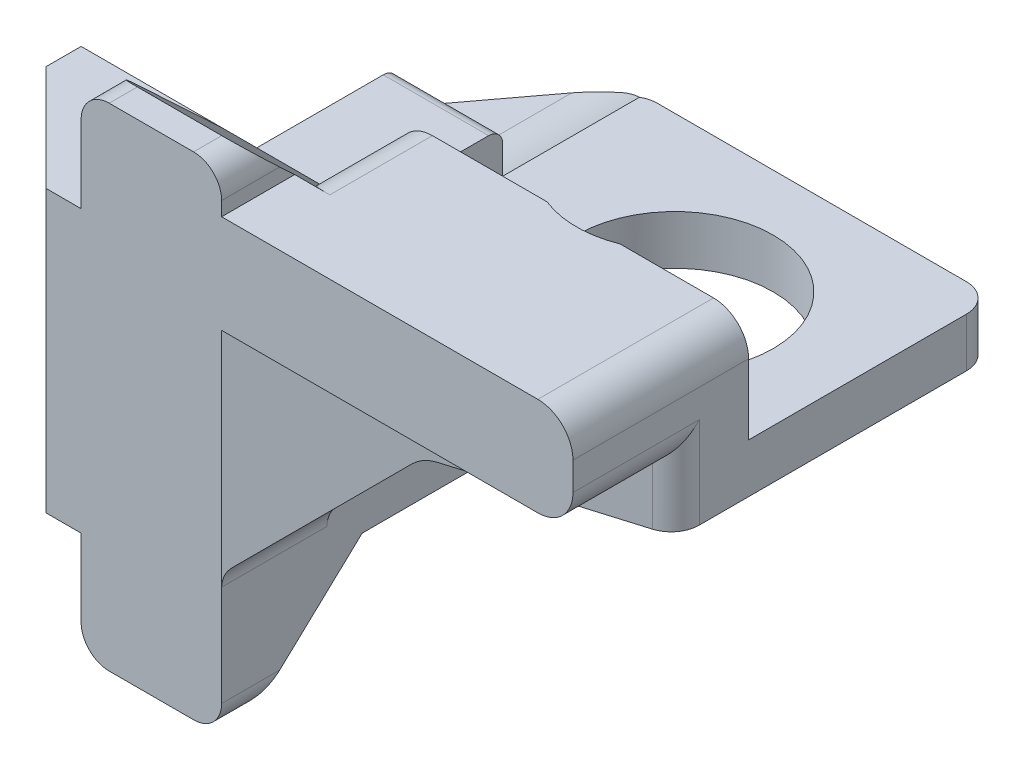
from build123d import *

# Parameters (mm, degrees)
SKETCH1_W                = 40
SKETCH1_H                = 40
BOSS_EXTRUDE1_DEPTH      = 40
SKETCH2_W                = 25
SKETCH2_H                = 20
CUT_EXTRUDE1_DEPTH       = 40
CHAMFER1_SIZE            = 15
CUT_EXTRUDE2_DEPTH       = 15
CHAMFER2_SIZE            = 4
SKETCH4_R                = 2.6
CUT_EXTRUDE3_DEPTH       = 17
BOSS_EXTRUDE3_DEPTH      = 20
FILLET3_R                = 4
BOSS_EXTRUDE2_DEPTH      = 20
BOSS_EXTRUDE2_DEPTH_BACK = 25
SKETCH5_W                = 50
SKETCH5_H                = 8
SKETCH10_R               = 14
CUT_EXTRUDE4_DEPTH       = 10
CHAMFER3_SIZE            = 15
CHAMFER3_SIZE_2          = 20
CHAMFER4_SIZE2           = 50
CHAMFER4_SIZE            = 15
FILLET5_START            = 26
FILLET5_DEPTH            = 10
FILLET6_R                = 2
CHAMFER5_SIZE            = 22
SKETCH11_W               = 27.237482008
SKETCH11_H               = 25
CUT_EXTRUDE5_DEPTH       = 25
FILLET7_R                = 4
SKETCH16_W               = 14
SKETCH16_H               = 14
CUT_EXTRUDE6_DEPTH       = 43
CHAMFER6_SIZE            = 10
CHAMFER6_SIZE2           = 2
FILLET9_R                = 2
SKETCH18_W               = 50
SKETCH18_H               = 14
BOSS_EXTRUDE4_DEPTH      = 25
SKETCH19_R               = 2.25
CUT_EXTRUDE7_DEPTH       = 15
FILLET10_R               = 5
SKETCH20_W               = 50
SKETCH20_H               = 1
CUT_EXTRUDE8_DEPTH       = 69
FILLET11_R               = 10
SKETCH21_R               = 14
CUT_EXTRUDE9_DEPTH       = 69


with BuildPart() as part:
    # Sketch1 → Boss-Extrude1 (new body)
    with BuildSketch(Plane(origin=(0, 0, 0), x_dir=(1, 0, 0), z_dir=(0, 1, 0))):
        with Locations((20, 20)):
            Rectangle(SKETCH1_W, SKETCH1_H)
    extrude(amount=BOSS_EXTRUDE1_DEPTH)

    # Sketch2 → Cut-Extrude1 (cut)
    with BuildSketch(Plane(origin=(0, 40, 0), x_dir=(1, 0, 0), z_dir=(0, 1, 0))):
        with Locations((12.5, 30)):
            Rectangle(SKETCH2_W, SKETCH2_H)
    extrude(amount=-CUT_EXTRUDE1_DEPTH, mode=Mode.SUBTRACT)

    # Chamfer1
    chamfer1_edges = [part.edges().sort_by_distance(p)[0] for p in [
        (0, 20, 0),
    ]]
    chamfer(chamfer1_edges, length=CHAMFER1_SIZE)

    # Sketch3 → Cut-Extrude2 (cut)
    with BuildSketch(Plane.XY):
        Polygon((0, 10), (0, 15), (15, 15), (15, 5), (0, 5), align=None)
        Polygon((0, 30), (0, 25), (15, 25), (15, 35), (0, 35), align=None)
    extrude(amount=-CUT_EXTRUDE2_DEPTH, mode=Mode.SUBTRACT)

    # Chamfer2
    chamfer2_edges = [part.edges().sort_by_distance(p)[0] for p in [
        (15, 35, -7.5),
        (15, 25, -7.5),
        (15, 15, -7.5),
        (15, 5, -7.5),
    ]]
    chamfer(chamfer2_edges, length=CHAMFER2_SIZE)

    # Sketch4 → Cut-Extrude3 (cut)
    with BuildSketch(Plane.XY.offset(-15)):
        with Locations((8, 30)):
            Circle(SKETCH4_R)
        with Locations((8, 10)):
            Circle(SKETCH4_R)
    extrude(amount=-CUT_EXTRUDE3_DEPTH, mode=Mode.SUBTRACT)

    # Sketch9 → Boss-Extrude3 (add)
    with BuildSketch(Plane(origin=(40, 0, 0), x_dir=(0, 0, -1), z_dir=(1, 0, 0))):
        Polygon((0, 40), (0, 55), (4, 55), (20, 40), align=None)
        Polygon((0, 0), (0, -15), (4, -15), (20, 0), align=None)
    extrude(amount=-BOSS_EXTRUDE3_DEPTH)

    # Fillet3
    fillet3_edges = [part.edges().sort_by_distance(p)[0] for p in [
        (20, 55, -2),
        (40, 55, -2),
        (20, -15, -2),
        (40, -15, -2),
    ]]
    fillet(fillet3_edges, radius=FILLET3_R)

    # Sketch5 → Boss-Extrude2 (add, two sides: drawn at the far end of the back side and taken through both)
    with BuildSketch(Plane(origin=(0, 0, -40), x_dir=(-1, 0, 0), z_dir=(0, 0, -1)).offset(-BOSS_EXTRUDE2_DEPTH_BACK)):
        with Locations((-65, 31)):
            Rectangle(SKETCH5_W, SKETCH5_H)
    extrude(amount=BOSS_EXTRUDE2_DEPTH + BOSS_EXTRUDE2_DEPTH_BACK)

    # Sketch10 → Cut-Extrude4 (cut)
    with BuildSketch(Plane(origin=(0, 27, 0), x_dir=(-1, 0, 0), z_dir=(0, -1, 0))):
        with Locations(Location((-66.5, 38, 0), (0, 0, 90))):
            Circle(SKETCH10_R)
    extrude(amount=-CUT_EXTRUDE4_DEPTH, mode=Mode.SUBTRACT)

    # Chamfer3
    # the kernel refuses this chamfer: 20, 15 mm, written as the material it adds along each edge
    with BuildSketch(Plane(origin=(40, 27, -40), x_dir=(-1, 0, 0), z_dir=(0, 1, 0))) as chamfer3_piece_1:
        Polygon((CHAMFER3_SIZE, 0), (0, -CHAMFER3_SIZE_2), (0, 0), align=None)
    extrude(amount=8)

    # Chamfer4
    chamfer4_edges = [part.edges().sort_by_distance(p)[0] for p in [
        (40, 31, -15),
    ]]
    chamfer4_side = [part.faces().sort_by_distance(p)[0] for p in [
        (40, 31, -14.7),
    ]]
    chamfer(chamfer4_edges, length=CHAMFER4_SIZE - 0.0001, length2=CHAMFER4_SIZE2 - 0.0001, reference=chamfer4_side[0])  # a hair under: the kernel refuses the full size

    # Fillet5: read off the stored shape, not the designer's step
    # Fillet5 outline → Fillet5 (cut)
    with BuildSketch(Plane(origin=(0, 0, 0), x_dir=(1, 0, 0), z_dir=(0, 1, 0)).offset(FILLET5_START)):
        with BuildLine():
            Line((90, 15), (90, 17.976122604))
            ThreePointArc((90, 17.976122604), (89.209171713, 15.588400485), (87.149391542, 14.144817463))
            Line((87.149391542, 14.144817463), (90, 15))
        make_face()
        with BuildLine():
            ThreePointArc((38.8, 58.4), (40.211145618, 59.577708764), (42, 60))
            Line((42, 60), (40, 60))
            Line((40, 60), (38.8, 58.4))
        make_face()
        with BuildLine():
            ThreePointArc((86, 60), (88.828427125, 58.828427125), (90, 56))
            Line((90, 56), (90, 60))
            Line((90, 60), (86, 60))
        make_face()
    extrude(amount=FILLET5_DEPTH, mode=Mode.SUBTRACT)

    # Fillet6
    fillet6_edges = [part.edges().sort_by_distance(p)[0] for p in [
        (32.5, 40, -40),
        (32.5, 0, -40),
    ]]
    fillet(fillet6_edges, radius=FILLET6_R)

    # Chamfer5
    # the kernel refuses this chamfer: 22 mm, written as the material it adds along each edge
    with BuildSketch(Plane(origin=(40, 27, 56.576925735), x_dir=(1, 0, 0), z_dir=(0, 0, -1))) as chamfer5_piece_1_section:
        Polygon((CHAMFER5_SIZE, 0), (0, CHAMFER5_SIZE), (0, 0), align=None)
    chamfer5_piece_1 = extrude(amount=96.576925735, mode=Mode.PRIVATE)
    chamfer5_piece_1 = split(chamfer5_piece_1, bisect_by=Plane(origin=(24.428402209, 27, 4.671357537), z_dir=(-0.2873466553275782, 0, -0.9578266542919204)), keep=Keep.TOP, mode=Mode.PRIVATE)
    chamfer5_piece_1 = chamfer5_piece_1 - Plane(origin=(66.5, 27, -38), x_dir=(0, 0, -1), z_dir=(0, -1, 0)) * Cylinder(14, 282, mode=Mode.PRIVATE)
    chamfer5_piece_1 = split(chamfer5_piece_1, bisect_by=Plane(origin=(40, 27, 0), z_dir=(0, 0, -1)), keep=Keep.TOP, mode=Mode.PRIVATE)
    add(chamfer5_piece_1)

    # Sketch11 → Cut-Extrude5 (cut)
    with BuildSketch(Plane(origin=(0, 0, -40), x_dir=(-1, 0, 0), z_dir=(0, 0, -1))):
        with Locations((-53.618741004, 14.5)):
            Rectangle(SKETCH11_W, SKETCH11_H)
    extrude(amount=-CUT_EXTRUDE5_DEPTH, mode=Mode.SUBTRACT)

    # Fillet7
    fillet7_edges = [part.edges().sort_by_distance(p)[0] for p in [
        (62, 27, -10.8000346),
        (40, 5, -7.50005),
    ]]
    fillet(fillet7_edges, radius=FILLET7_R)

    # Sketch16 → Cut-Extrude6 (cut)
    with BuildSketch(Plane.ZY):
        with Locations((-29, 20)):
            Rectangle(SKETCH16_W, SKETCH16_H)
    extrude(amount=-CUT_EXTRUDE6_DEPTH, mode=Mode.SUBTRACT)

    # Chamfer6
    chamfer6_edges = [part.edges().sort_by_distance(p)[0] for p in [
        (40, 20, -36),
    ]]
    chamfer6_side = [part.faces().sort_by_distance(p)[0] for p in [
        (32.5, 20, -36),
    ]]
    chamfer(chamfer6_edges, length=CHAMFER6_SIZE, length2=CHAMFER6_SIZE2, reference=chamfer6_side[0])

    # Fillet9
    fillet9_edges = [part.edges().sort_by_distance(p)[0] for p in [
        (32.5, 13, -22),
        (32.5, 27, -22),
        (27.5, 27, -36),
        (27.5, 13, -36),
        (35, 13, -37),
        (35, 27, -37),
    ]]
    fillet(fillet9_edges, radius=FILLET9_R)

    # Sketch18 → Boss-Extrude4 (add)
    with BuildSketch(Plane.XY):
        with Locations((65, 42)):
            Rectangle(SKETCH18_W, SKETCH18_H)
    extrude(amount=-BOSS_EXTRUDE4_DEPTH)

    # Sketch19 → Cut-Extrude7 (cut)
    with BuildSketch(Plane(origin=(0, 0, -25), x_dir=(-1, 0, 0), z_dir=(0, 0, -1))):
        with Locations((-79.5, 45)):
            Circle(SKETCH19_R)
        with Locations(Location((-79.5, 37, 0), (0, 0, 297.266044451))):
            Circle(SKETCH19_R)
        with Locations((-53.5, 45)):
            Circle(SKETCH19_R)
        with Locations((-53.5, 37)):
            Circle(SKETCH19_R)
    extrude(amount=-CUT_EXTRUDE7_DEPTH, mode=Mode.SUBTRACT)

    # Fillet10
    fillet10_edges = [part.edges().sort_by_distance(p)[0] for p in [
        (90, 35, -8.988061302),
        (90, 49, -12.5),
        (40, 49, -17.7),
    ]]
    fillet(fillet10_edges, radius=FILLET10_R)

    # Sketch20 → Cut-Extrude8 (cut)
    with BuildSketch(Plane(origin=(0, 0, -25), x_dir=(-1, 0, 0), z_dir=(0, 0, -1))):
        with Locations((-65, 34.5)):
            Rectangle(SKETCH20_W, SKETCH20_H)
    extrude(amount=CUT_EXTRUDE8_DEPTH, mode=Mode.SUBTRACT)

    # Fillet11
    # the kernel refuses this fillet: 10 mm, written as the material it takes off along each edge
    with BuildSketch(Plane(origin=(40, 35, -40), x_dir=(-1, 0, 0), z_dir=(0, 0, -1))) as fillet11_piece_1:
        with BuildLine():
            CenterArc((4.358898944, -10), FILLET11_R, 90, 25.841932763)
            Line((0, -1), (0, 0))
            Line((0, 0), (4.358898944, 0))
        make_face()
    extrude(amount=30.361348974, mode=Mode.SUBTRACT)

    # Sketch21 → Cut-Extrude9 (cut)
    with BuildSketch(Plane.XZ.offset(-35)):
        with Locations(Location((66.5, -38, 0), (0, 0, 270))):
            Circle(SKETCH21_R)
    extrude(amount=-CUT_EXTRUDE9_DEPTH, mode=Mode.SUBTRACT)


solid = part.part
